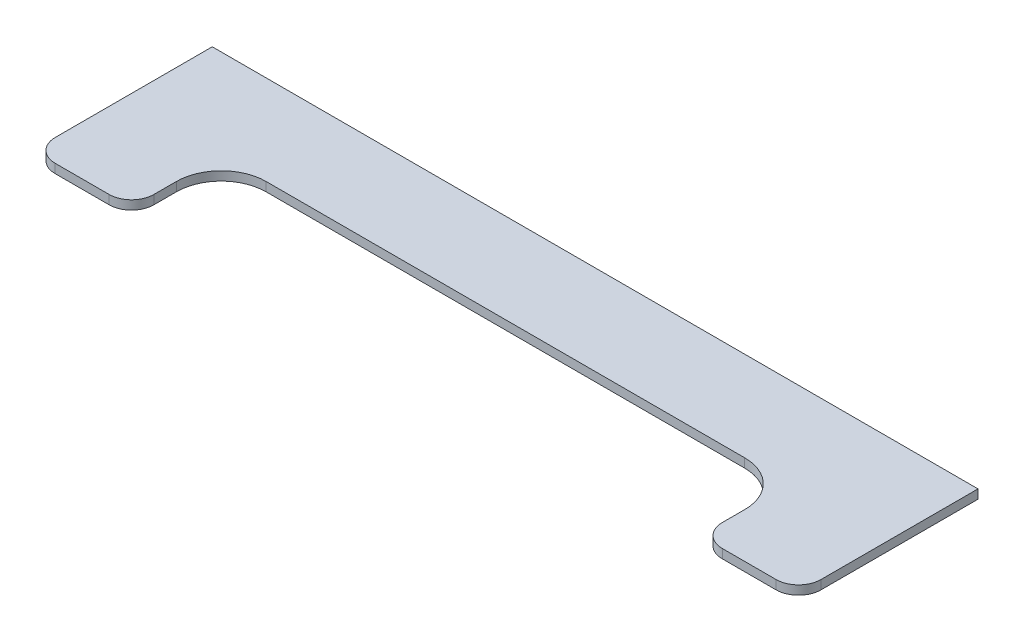
from build123d import *

# Parameters (mm, degrees)
EXTRUDE_1_DEPTH = 6


with BuildPart() as part:
    # Эскиз1 → Бобышка-Вытянуть1 (new body)
    with BuildSketch(Plane(origin=(0, 0, 0), x_dir=(1, 0, 0), z_dir=(0, 1, 0))):
        with BuildLine():
            Line((-330.202898551, 15), (-330.202898551, 120))
            Line((-330.202898551, 120), (181.797101449, 120))
            Line((181.797101449, 120), (181.797101449, 15))
            ThreePointArc((181.797101449, 15), (177.403703167, 4.393398282), (166.797101449, 0))
            Line((166.797101449, 0), (130.797101449, 0))
            ThreePointArc((130.797101449, 0), (120.190499731, 4.393398282), (115.797101449, 15))
            Line((115.797101449, 15), (115.797101449, 30))
            ThreePointArc((115.797101449, 30), (107.010304885, 51.213203436), (85.797101449, 60))
            Line((85.797101449, 60), (-234.202898551, 60))
            ThreePointArc((-234.202898551, 60), (-255.416101986, 51.213203436), (-264.202898551, 30))
            Line((-264.202898551, 30), (-264.202898551, 15))
            ThreePointArc((-264.202898551, 15), (-268.596296833, 4.393398282), (-279.202898551, 0))
            Line((-279.202898551, 0), (-315.202898551, 0))
            ThreePointArc((-315.202898551, 0), (-325.809500269, 4.393398282), (-330.202898551, 15))
        make_face()
    extrude(amount=EXTRUDE_1_DEPTH)


solid = part.part
